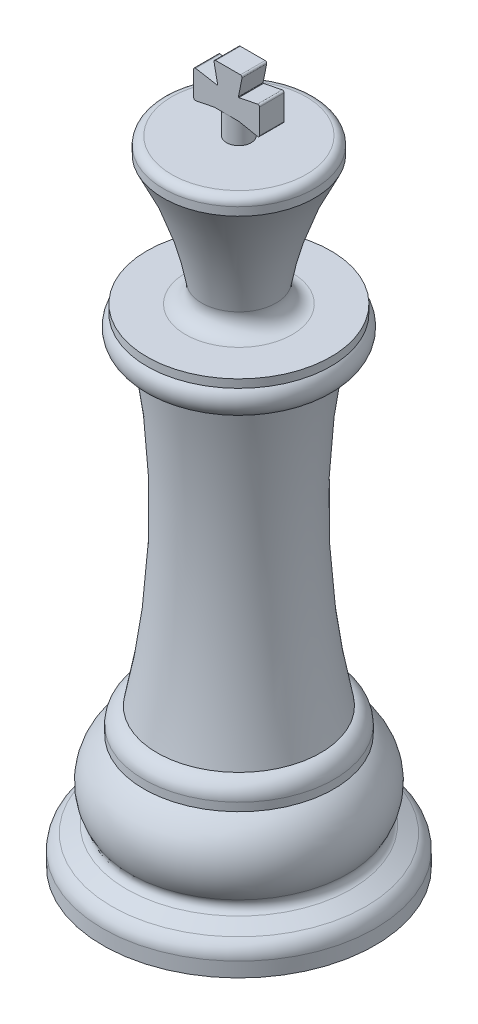
from build123d import *

# Parameters (mm, degrees)
BOSS_EXTRUDE1_DEPTH = 3
FILLET1_R           = 2
FILLET2_R           = 1
FILLET3_R           = 2


with BuildPart() as part:
    # Sketch3 → Revolve1 (revolve)
    with BuildSketch(Plane.XY):
        with BuildLine():
            Line((-0.682303149, 69.43), (-0.682303149, -10.57))
            Line((-0.682303149, -10.57), (13.872355854, -10.57))
            Line((13.872355854, -10.57), (15.872355854, -10.57))
            Line((15.872355854, -10.57), (15.872355854, -7.57))
            Line((15.872355854, -7.57), (11.904936135, -5.57))
            ThreePointArc((11.904936135, -5.57), (13.42384482, -0.850718375), (10.872355854, 3.4))
            Line((10.872355854, 3.4), (10.872355854, 4.4))
            ThreePointArc((10.872355854, 4.4), (10.429261188, 5.693451807), (9.258731345, 6.4))
            ThreePointArc((9.258731345, 6.4), (7.057404899, 25.363621612), (8.5, 44.4))
            ThreePointArc((8.5, 44.4), (10.789695479, 45.283075013), (10.5, 47.72))
            Line((10.5, 47.72), (10.5, 48.72))
            Line((10.5, 48.72), (3.5, 48.72))
            ThreePointArc((3.5, 48.72), (5.233498382, 56.818953411), (8.5, 64.43))
            Line((8.5, 64.43), (8.5, 65.43))
            ThreePointArc((8.5, 65.43), (8.207106781, 66.137106781), (7.5, 66.43))
            Line((7.5, 66.43), (0.817696851, 66.43))
            Line((0.817696851, 66.43), (0.817696851, 69.43))
            Line((0.817696851, 69.43), (-0.682303149, 69.43))
        make_face()
    revolve(axis=Axis((-0.682303149, 69.43, 0), (0, -1, 0)))

    # Sketch4 → Boss-Extrude1 (add)
    with BuildSketch(Plane.XY.offset(1.498594167)):
        with BuildLine():
            Line((3.078473624, 72.382155355), (0.817696851, 71.93))
            Line((0.817696851, 71.93), (0.805441585, 71.93))
            ThreePointArc((0.805441585, 71.93), (0.766774478, 71.948300555), (0.756412551, 71.989805807))
            Line((0.756412551, 71.989805807), (1.196606744, 74.190776773))
            ThreePointArc((1.196606744, 74.190776773), (1.155159038, 74.356797781), (1.000490609, 74.43))
            Line((1.000490609, 74.43), (-2.01158783, 74.43))
            ThreePointArc((-2.01158783, 74.43), (-2.166256258, 74.356797781), (-2.207703965, 74.190776773))
            Line((-2.207703965, 74.190776773), (-1.767509772, 71.989805807))
            ThreePointArc((-1.767509772, 71.989805807), (-1.777871698, 71.948300555), (-1.816538805, 71.93))
            Line((-1.816538805, 71.93), (-1.828794072, 71.93))
            Line((-1.828794072, 71.93), (-4.447784486, 72.388906971))
            ThreePointArc((-4.447784486, 72.388906971), (-4.610942698, 72.345048358), (-4.682303149, 72.191908337))
            Line((-4.682303149, 72.191908337), (-4.682303149, 69.173960781))
            ThreePointArc((-4.682303149, 69.173960781), (-4.60910093, 69.019292352), (-4.443079922, 68.977844645))
            Line((-4.443079922, 68.977844645), (-2.18715798, 69.429029034))
            ThreePointArc((-2.18715798, 69.429029034), (-2.182279054, 69.429756666), (-2.177352173, 69.43))
            Line((-2.177352173, 69.43), (0.812745876, 69.43))
            ThreePointArc((0.812745876, 69.43), (0.817672757, 69.429756666), (0.822551682, 69.429029034))
            Line((0.822551682, 69.429029034), (3.078473624, 68.977844645))
            ThreePointArc((3.078473624, 68.977844645), (3.244494632, 69.019292352), (3.317696851, 69.173960781))
            Line((3.317696851, 69.173960781), (3.317696851, 72.186039219))
            ThreePointArc((3.317696851, 72.186039219), (3.244494632, 72.340707648), (3.078473624, 72.382155355))
        make_face()
    extrude(amount=-BOSS_EXTRUDE1_DEPTH)

    # Fillet1
    fillet1_edges = [part.edges().sort_by_distance(p)[0] for p in [
        (-17.236962152, -7.57, 0),
    ]]
    fillet(fillet1_edges, radius=FILLET1_R)

    # Fillet2
    fillet2_edges = [part.edges().sort_by_distance(p)[0] for p in [
        (-13.269542432, -5.57, 0),
    ]]
    fillet(fillet2_edges, radius=FILLET2_R)

    # Fillet3
    fillet3_edges = [part.edges().sort_by_distance(p)[0] for p in [
        (-4.864606297, 48.72, 0),
    ]]
    fillet(fillet3_edges, radius=FILLET3_R)


solid = part.part
